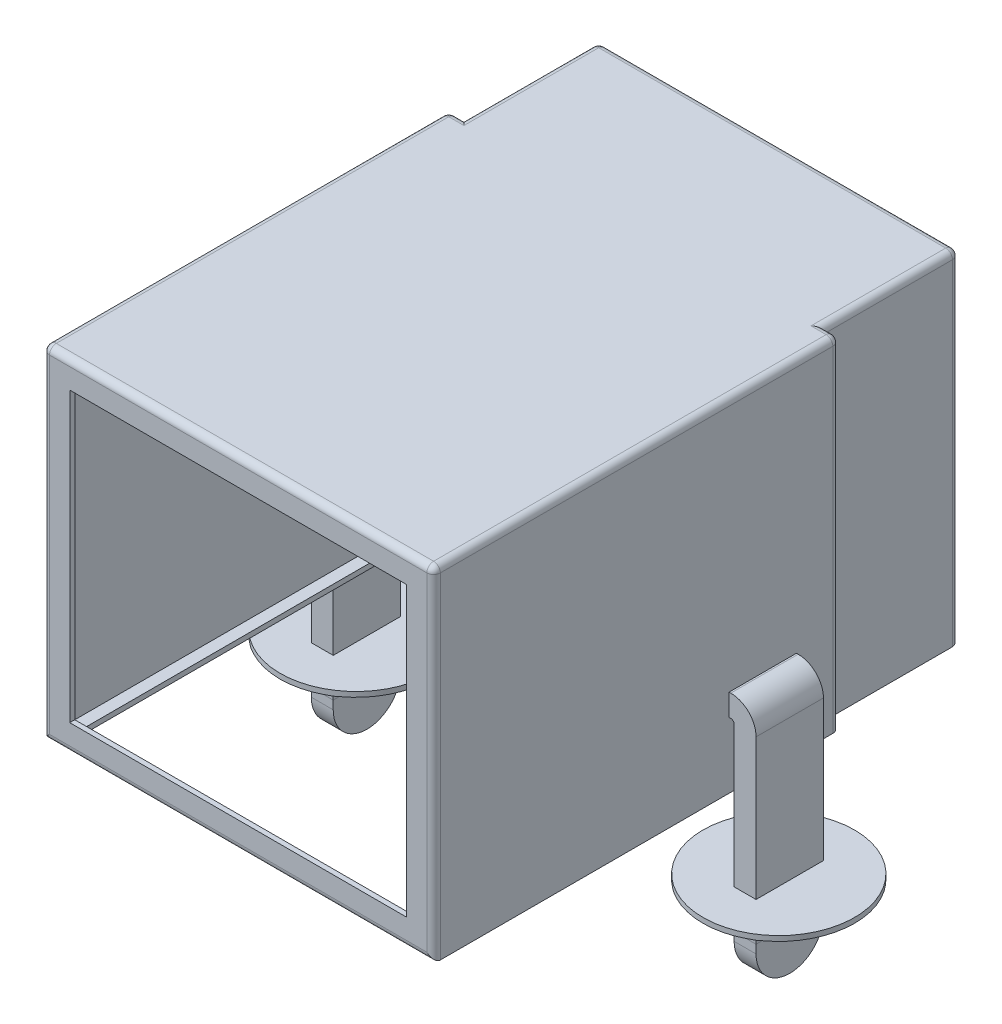
from build123d import *

# Parameters (mm, degrees)
BOSS_EXTRUDE1_DEPTH      = 0.15
BOSS_EXTRUDE1_DEPTH_BACK = 10
BOSS_EXTRUDE2_DEPTH      = 0.15
BOSS_EXTRUDE3_DEPTH      = 0.15
SKETCH6_W                = 10
SKETCH6_H                = 8.55
CUT_EXTRUDE1_DEPTH       = 0.15
CUT_EXTRUDE3_DEPTH       = 0.15
INDENT1_START            = -4.25
INDENT1_OUTLINE_W        = 0.15
INDENT1_OUTLINE_H        = 0.35
INDENT1_DEPTH            = 1
INDENT1_START_2          = -0.5
INDENT1_2_OUTLINE_W      = 0.15
INDENT1_2_OUTLINE_H      = 0.35
INDENT1_2_DEPTH          = 1
INDENT1_START_3          = 3.25
INDENT1_3_OUTLINE_W      = 0.15
INDENT1_3_OUTLINE_H      = 0.35
INDENT1_3_DEPTH          = 1
EXTRUDE_THIN2_DEPTH      = 2
FILLET1_R                = 1
FILLET1_OF_MIRROR1_R     = 1
SKETCH10_R               = 2.25
BOSS_EXTRUDE4_DEPTH      = 0.15
FILLET2_R                = 1
FILLET4_R                = 0.2
FILLET5_R                = 0.2
FILLET6_R                = 0.2


# Read off the part's stored shape, not the designer's step: Indent1
# Some blends are built 0.0001 mm under size
with BuildPart() as part:
    # Sketch1 → Boss-Extrude1 (new, two sides: drawn at the far end of the back side and taken through both)
    with BuildSketch(Plane(origin=(0, 10.25, 0), x_dir=(1, 0, 0), z_dir=(0, 1, 0)).offset(-BOSS_EXTRUDE1_DEPTH_BACK)):
        Polygon((5.8, 12.28), (5.35, 12.28), (5.35, 16.28), (-5.35, 16.28), (-5.35, 12.28), (-5.8, 12.28), (-5.8, 0.23), (5.8, 0.23), align=None)
        Polygon((5.65, 12.13), (5.2, 12.13), (5.2, 16.13), (-5.2, 16.13), (-5.2, 12.13), (-5.65, 12.13), (-5.65, 0.38), (5.65, 0.38), align=None, mode=Mode.SUBTRACT)
    extrude(amount=BOSS_EXTRUDE1_DEPTH + BOSS_EXTRUDE1_DEPTH_BACK)

    # Sketch4 → Boss-Extrude2 (add)
    with BuildSketch(Plane(origin=(0, 10.4, 0), x_dir=(1, 0, 0), z_dir=(0, 1, 0))):
        Polygon((5.8, 0.23), (5.8, 12.28), (5.35, 12.28), (5.35, 16.28), (-5.35, 16.28), (-5.35, 12.28), (-5.8, 12.28), (-5.8, 0.23), align=None)
    extrude(amount=-BOSS_EXTRUDE2_DEPTH)

    # Sketch5 → Boss-Extrude3 (add)
    with BuildSketch(Plane.XZ.offset(-0.25)):
        Polygon((5.8, -12.28), (5.8, -0.23), (-5.8, -0.23), (-5.8, -12.28), (-5.35, -12.28), (-5.35, -16.28), (5.35, -16.28), (5.35, -12.28), align=None)
    extrude(amount=-BOSS_EXTRUDE3_DEPTH)

    # Sketch6 → Cut-Extrude1 (cut)
    with BuildSketch(Plane.XY.offset(-0.23)):
        with Locations((0, 5.325)):
            Rectangle(SKETCH6_W, SKETCH6_H)
    extrude(amount=-CUT_EXTRUDE1_DEPTH, mode=Mode.SUBTRACT)

    # Sketch7 → Cut-Extrude3 (cut)
    with BuildSketch(Plane.XZ.offset(-0.25)):
        Polygon((4.85, -15.78), (4.85, -11.78), (5.3, -11.78), (5.3, -0.73), (-5.3, -0.73), (-5.3, -11.78), (-4.85, -11.78), (-4.85, -15.78), align=None)
    extrude(amount=-CUT_EXTRUDE3_DEPTH, mode=Mode.SUBTRACT)

    # Indent1 outline → Indent1 (cut)
    with BuildSketch(Plane.YZ.offset(INDENT1_START)):
        with Locations((0.325, -15.955)):
            Rectangle(INDENT1_OUTLINE_W, INDENT1_OUTLINE_H)
    extrude(amount=INDENT1_DEPTH, mode=Mode.SUBTRACT)

    # Indent1 2 outline → Indent1 2 (cut)
    with BuildSketch(Plane.YZ.offset(INDENT1_START_2)):
        with Locations((0.325, -15.955)):
            Rectangle(INDENT1_2_OUTLINE_W, INDENT1_2_OUTLINE_H)
    extrude(amount=INDENT1_2_DEPTH, mode=Mode.SUBTRACT)

    # Indent1 3 outline → Indent1 3 (cut)
    with BuildSketch(Plane.YZ.offset(INDENT1_START_3)):
        with Locations((0.325, -15.955)):
            Rectangle(INDENT1_3_OUTLINE_W, INDENT1_3_OUTLINE_H)
    extrude(amount=INDENT1_3_DEPTH, mode=Mode.SUBTRACT)

    # Sketch9 → Extrude-Thin2 (add)
    with BuildSketch(Plane.XY.offset(-11)):
        with BuildLine():
            Line((5.8, 2.2), (5.85, 2.2))
            ThreePointArc((5.85, 2.2), (5.920710678, 2.170710678), (5.95, 2.1))
            Line((5.95, 2.1), (5.95, -4.48))
            Line((5.95, -4.48), (6.6, -4.48))
            Line((6.6, -4.48), (6.6, 2.1))
            ThreePointArc((6.6, 2.1), (6.380330086, 2.630330086), (5.85, 2.85))
            Line((5.85, 2.85), (5.8, 2.85))
            Line((5.8, 2.85), (5.8, 2.2))
        make_face()
    extrude_thin2 = extrude(amount=EXTRUDE_THIN2_DEPTH)

    # Fillet1
    fillet1_edges = [part.edges().sort_by_distance(p)[0] for p in [
        (6.275, -4.48, -11),
        (6.275, -4.48, -9),
    ]]
    fillet(fillet1_edges, radius=FILLET1_R - 0.0001)  # a hair under: the kernel refuses the full size

    # Mirror1: Extrude-Thin2 across plane
    add(extrude_thin2.mirror(Plane(origin=(0, 0, 0), x_dir=(0, 0, 1), z_dir=(1, 0, 0))))

    # Fillet1 of Mirror1
    fillet1_of_mirror1_edges = [part.edges().sort_by_distance(p)[0] for p in [
        (-6.275, -4.48, -11),
        (-6.275, -4.48, -9),
    ]]
    fillet(fillet1_of_mirror1_edges, radius=FILLET1_OF_MIRROR1_R - 0.0001)  # a hair under: the kernel refuses the full size

    # Sketch10 → Boss-Extrude4 (add)
    with BuildSketch(Plane(origin=(0, -2.08, 0), x_dir=(-1, 0, 0), z_dir=(0, -1, 0))):
        with Locations(Location((-6.275, 10, 0), (0, 0, 90))):
            Circle(SKETCH10_R)
        with Locations(Location((6.275, 10, 0), (0, 0, 90))):
            Circle(SKETCH10_R)
    extrude(amount=BOSS_EXTRUDE4_DEPTH)

    # Fillet2
    # the kernel refuses this fillet: 1 mm, written as the material it adds along each edge
    with BuildSketch(Plane(origin=(5.95, -2.23, -11), x_dir=(0, 0, -1), z_dir=(1, 0, 0)), Plane(origin=(-5.95, -2.23, -9), x_dir=(0, 0, 1), z_dir=(-1, 0, 0))) as fillet2_piece_1:
        with BuildLine():
            CenterArc((FILLET2_R, -FILLET2_R), FILLET2_R, 90, 90)
            Line((0, -FILLET2_R), (0, 0))
            Line((0, 0), (FILLET2_R, 0))
        make_face()
    extrude(amount=0.65)
    with BuildSketch(Plane(origin=(5.95, -2.23, -9), x_dir=(-1, 0, 0), z_dir=(0, 0, -1)), Plane(origin=(6.6, -2.23, -11), x_dir=(1, 0, 0), z_dir=(0, 0, 1))) as fillet2_piece_2:
        with BuildLine():
            CenterArc((FILLET2_R, -FILLET2_R), FILLET2_R, 90, 90)
            Line((0, -FILLET2_R), (0, 0))
            Line((0, 0), (FILLET2_R, 0))
        make_face()
    extrude(amount=2)
    with BuildSketch(Plane(origin=(5.95, -2.23, -9), x_dir=(0, 0, 1), z_dir=(1, 0, 0)), Plane(origin=(-5.95, -2.23, -11), x_dir=(0, 0, -1), z_dir=(-1, 0, 0))) as fillet2_piece_3:
        with BuildLine():
            CenterArc((FILLET2_R, FILLET2_R), FILLET2_R, 180, 90)
            Line((0, FILLET2_R), (0, 0))
            Line((0, 0), (FILLET2_R, 0))
        make_face()
    extrude(amount=0.65)
    with BuildSketch(Plane(origin=(-6.6, -2.23, -11), x_dir=(-1, 0, 0), z_dir=(0, 0, 1)), Plane(origin=(-5.95, -2.23, -9), x_dir=(1, 0, 0), z_dir=(0, 0, -1))) as fillet2_piece_4:
        with BuildLine():
            CenterArc((FILLET2_R, FILLET2_R), FILLET2_R, 180, 90)
            Line((0, FILLET2_R), (0, 0))
            Line((0, 0), (FILLET2_R, 0))
        make_face()
    extrude(amount=2)
    with BuildSketch(Plane(origin=(3.45, -2.23, -11), x_dir=(0, 0, -1), z_dir=(1, 0, 0))) as fillet2_piece_5a_section:
        with BuildLine():
            CenterArc((FILLET2_R, -FILLET2_R), FILLET2_R, 90, 90)
            Line((0, -FILLET2_R), (0, 0))
            Line((0, 0), (FILLET2_R, 0))
        make_face()
    fillet2_piece_5a = extrude(amount=3.15, mode=Mode.PRIVATE)
    fillet2_piece_5a = fillet2_piece_5a & Plane(origin=(6.275, -2.469343422, -10), x_dir=(0, 0, -1), z_dir=(0, 1, 0)) * Cylinder(2.25, 11, mode=Mode.PRIVATE)
    fillet2_piece_5a = split(fillet2_piece_5a, bisect_by=Plane(origin=(5.95, -2.469343422, -11.202931819), z_dir=(-1, 0, 0)), keep=Keep.TOP, mode=Mode.PRIVATE)
    with BuildSketch(Plane(origin=(5.95, -2.23, -9), x_dir=(-1, 0, 0), z_dir=(0, 0, -1))) as fillet2_piece_5b_section:
        with BuildLine():
            CenterArc((FILLET2_R, -FILLET2_R), FILLET2_R, 90, 90)
            Line((0, -FILLET2_R), (0, 0))
            Line((0, 0), (FILLET2_R, 0))
        make_face()
    fillet2_piece_5b = extrude(amount=4.5, mode=Mode.PRIVATE)
    fillet2_piece_5b = fillet2_piece_5b & Plane(origin=(6.275, -2.463222845, -10), x_dir=(0, 0, -1), z_dir=(0, 1, 0)) * Cylinder(2.25, 13, mode=Mode.PRIVATE)
    fillet2_piece_5b = split(fillet2_piece_5b, bisect_by=Plane(origin=(5.736277315, -2.463222845, -11), z_dir=(0, 0, -1)), keep=Keep.TOP, mode=Mode.PRIVATE)
    fillet2_piece_5 = fillet2_piece_5a & fillet2_piece_5b
    add(fillet2_piece_5)
    with BuildSketch(Plane(origin=(5.95, -2.23, -11), x_dir=(0, 0, -1), z_dir=(1, 0, 0))) as fillet2_piece_6a_section:
        with BuildLine():
            CenterArc((FILLET2_R, -FILLET2_R), FILLET2_R, 90, 90)
            Line((0, -FILLET2_R), (0, 0))
            Line((0, 0), (FILLET2_R, 0))
        make_face()
    fillet2_piece_6a = extrude(amount=3.15, mode=Mode.PRIVATE)
    fillet2_piece_6a = fillet2_piece_6a & Plane(origin=(6.275, -2.469343173, -10), x_dir=(0, 0, -1), z_dir=(0, 1, 0)) * Cylinder(2.25, 11, mode=Mode.PRIVATE)
    fillet2_piece_6a = split(fillet2_piece_6a, bisect_by=Plane(origin=(6.6, -2.469343173, -11.202931595), z_dir=(1, 0, 0)), keep=Keep.TOP, mode=Mode.PRIVATE)
    with BuildSketch(Plane(origin=(6.6, -2.23, -13.5), x_dir=(1, 0, 0), z_dir=(0, 0, 1))) as fillet2_piece_6b_section:
        with BuildLine():
            CenterArc((FILLET2_R, -FILLET2_R), FILLET2_R, 90, 90)
            Line((0, -FILLET2_R), (0, 0))
            Line((0, 0), (FILLET2_R, 0))
        make_face()
    fillet2_piece_6b = extrude(amount=4.5, mode=Mode.PRIVATE)
    fillet2_piece_6b = fillet2_piece_6b & Plane(origin=(6.275, -2.463222813, -10), x_dir=(0, 0, -1), z_dir=(0, 1, 0)) * Cylinder(2.25, 13, mode=Mode.PRIVATE)
    fillet2_piece_6b = split(fillet2_piece_6b, bisect_by=Plane(origin=(6.813722651, -2.463222813, -11), z_dir=(0, 0, -1)), keep=Keep.TOP, mode=Mode.PRIVATE)
    fillet2_piece_6 = fillet2_piece_6a & fillet2_piece_6b
    add(fillet2_piece_6)
    with BuildSketch(Plane(origin=(3.45, -2.23, -9), x_dir=(0, 0, 1), z_dir=(1, 0, 0))) as fillet2_piece_7a_section:
        with BuildLine():
            CenterArc((FILLET2_R, FILLET2_R), FILLET2_R, 180, 90)
            Line((0, FILLET2_R), (0, 0))
            Line((0, 0), (FILLET2_R, 0))
        make_face()
    fillet2_piece_7a = extrude(amount=3.15, mode=Mode.PRIVATE)
    fillet2_piece_7a = fillet2_piece_7a & Plane(origin=(6.275, -2.469343173, -10), x_dir=(0, 0, -1), z_dir=(0, 1, 0)) * Cylinder(2.25, 11, mode=Mode.PRIVATE)
    fillet2_piece_7a = split(fillet2_piece_7a, bisect_by=Plane(origin=(5.95, -2.469343173, -8.797068405), z_dir=(-1, 0, 0)), keep=Keep.TOP, mode=Mode.PRIVATE)
    with BuildSketch(Plane(origin=(5.95, -2.23, -6.5), x_dir=(-1, 0, 0), z_dir=(0, 0, -1))) as fillet2_piece_7b_section:
        with BuildLine():
            CenterArc((FILLET2_R, -FILLET2_R), FILLET2_R, 90, 90)
            Line((0, -FILLET2_R), (0, 0))
            Line((0, 0), (FILLET2_R, 0))
        make_face()
    fillet2_piece_7b = extrude(amount=4.5, mode=Mode.PRIVATE)
    fillet2_piece_7b = fillet2_piece_7b & Plane(origin=(6.275, -2.463222813, -10), x_dir=(0, 0, -1), z_dir=(0, 1, 0)) * Cylinder(2.25, 13, mode=Mode.PRIVATE)
    fillet2_piece_7b = split(fillet2_piece_7b, bisect_by=Plane(origin=(5.736277349, -2.463222813, -9), z_dir=(0, 0, 1)), keep=Keep.TOP, mode=Mode.PRIVATE)
    fillet2_piece_7 = fillet2_piece_7a & fillet2_piece_7b
    add(fillet2_piece_7)
    with BuildSketch(Plane(origin=(6.6, -2.23, -11), x_dir=(1, 0, 0), z_dir=(0, 0, 1))) as fillet2_piece_8a_section:
        with BuildLine():
            CenterArc((FILLET2_R, -FILLET2_R), FILLET2_R, 90, 90)
            Line((0, -FILLET2_R), (0, 0))
            Line((0, 0), (FILLET2_R, 0))
        make_face()
    fillet2_piece_8a = extrude(amount=4.5, mode=Mode.PRIVATE)
    fillet2_piece_8a = fillet2_piece_8a & Plane(origin=(6.275, -2.463222845, -10), x_dir=(0, 0, -1), z_dir=(0, 1, 0)) * Cylinder(2.25, 13, mode=Mode.PRIVATE)
    fillet2_piece_8a = split(fillet2_piece_8a, bisect_by=Plane(origin=(6.813722685, -2.463222845, -9), z_dir=(0, 0, 1)), keep=Keep.TOP, mode=Mode.PRIVATE)
    with BuildSketch(Plane(origin=(5.95, -2.23, -9), x_dir=(0, 0, 1), z_dir=(1, 0, 0))) as fillet2_piece_8b_section:
        with BuildLine():
            CenterArc((FILLET2_R, FILLET2_R), FILLET2_R, 180, 90)
            Line((0, FILLET2_R), (0, 0))
            Line((0, 0), (FILLET2_R, 0))
        make_face()
    fillet2_piece_8b = extrude(amount=3.15, mode=Mode.PRIVATE)
    fillet2_piece_8b = fillet2_piece_8b & Plane(origin=(6.275, -2.469343422, -10), x_dir=(0, 0, -1), z_dir=(0, 1, 0)) * Cylinder(2.25, 11, mode=Mode.PRIVATE)
    fillet2_piece_8b = split(fillet2_piece_8b, bisect_by=Plane(origin=(6.6, -2.469343422, -8.797068181), z_dir=(1, 0, 0)), keep=Keep.TOP, mode=Mode.PRIVATE)
    fillet2_piece_8 = fillet2_piece_8a & fillet2_piece_8b
    add(fillet2_piece_8)
    with BuildSketch(Plane(origin=(-3.45, -2.23, -11), x_dir=(0, 0, -1), z_dir=(-1, 0, 0))) as fillet2_piece_9a_section:
        with BuildLine():
            CenterArc((FILLET2_R, FILLET2_R), FILLET2_R, 180, 90)
            Line((0, FILLET2_R), (0, 0))
            Line((0, 0), (FILLET2_R, 0))
        make_face()
    fillet2_piece_9a = extrude(amount=3.15, mode=Mode.PRIVATE)
    fillet2_piece_9a = fillet2_piece_9a & Plane(origin=(-6.275, -2.469343173, -10), x_dir=(0, 0, -1), z_dir=(0, 1, 0)) * Cylinder(2.25, 11, mode=Mode.PRIVATE)
    fillet2_piece_9a = split(fillet2_piece_9a, bisect_by=Plane(origin=(-5.95, -2.469343173, -11.202931595), z_dir=(1, 0, 0)), keep=Keep.TOP, mode=Mode.PRIVATE)
    with BuildSketch(Plane(origin=(-5.95, -2.23, -9), x_dir=(1, 0, 0), z_dir=(0, 0, -1))) as fillet2_piece_9b_section:
        with BuildLine():
            CenterArc((FILLET2_R, FILLET2_R), FILLET2_R, 180, 90)
            Line((0, FILLET2_R), (0, 0))
            Line((0, 0), (FILLET2_R, 0))
        make_face()
    fillet2_piece_9b = extrude(amount=4.5, mode=Mode.PRIVATE)
    fillet2_piece_9b = fillet2_piece_9b & Plane(origin=(-6.275, -2.463222813, -10), x_dir=(0, 0, -1), z_dir=(0, 1, 0)) * Cylinder(2.25, 13, mode=Mode.PRIVATE)
    fillet2_piece_9b = split(fillet2_piece_9b, bisect_by=Plane(origin=(-5.736277349, -2.463222813, -11), z_dir=(0, 0, -1)), keep=Keep.TOP, mode=Mode.PRIVATE)
    fillet2_piece_9 = fillet2_piece_9a & fillet2_piece_9b
    add(fillet2_piece_9)
    with BuildSketch(Plane(origin=(-6.6, -2.23, -13.5), x_dir=(-1, 0, 0), z_dir=(0, 0, 1))) as fillet2_piece_10a_section:
        with BuildLine():
            CenterArc((FILLET2_R, FILLET2_R), FILLET2_R, 180, 90)
            Line((0, FILLET2_R), (0, 0))
            Line((0, 0), (FILLET2_R, 0))
        make_face()
    fillet2_piece_10a = extrude(amount=4.5, mode=Mode.PRIVATE)
    fillet2_piece_10a = fillet2_piece_10a & Plane(origin=(-6.275, -2.463222845, -10), x_dir=(0, 0, -1), z_dir=(0, 1, 0)) * Cylinder(2.25, 13, mode=Mode.PRIVATE)
    fillet2_piece_10a = split(fillet2_piece_10a, bisect_by=Plane(origin=(-6.813722685, -2.463222845, -11), z_dir=(0, 0, -1)), keep=Keep.TOP, mode=Mode.PRIVATE)
    with BuildSketch(Plane(origin=(-5.95, -2.23, -11), x_dir=(0, 0, -1), z_dir=(-1, 0, 0))) as fillet2_piece_10b_section:
        with BuildLine():
            CenterArc((FILLET2_R, FILLET2_R), FILLET2_R, 180, 90)
            Line((0, FILLET2_R), (0, 0))
            Line((0, 0), (FILLET2_R, 0))
        make_face()
    fillet2_piece_10b = extrude(amount=3.15, mode=Mode.PRIVATE)
    fillet2_piece_10b = fillet2_piece_10b & Plane(origin=(-6.275, -2.469343422, -10), x_dir=(0, 0, -1), z_dir=(0, 1, 0)) * Cylinder(2.25, 11, mode=Mode.PRIVATE)
    fillet2_piece_10b = split(fillet2_piece_10b, bisect_by=Plane(origin=(-6.6, -2.469343422, -11.202931819), z_dir=(-1, 0, 0)), keep=Keep.TOP, mode=Mode.PRIVATE)
    fillet2_piece_10 = fillet2_piece_10a & fillet2_piece_10b
    add(fillet2_piece_10)
    with BuildSketch(Plane(origin=(-5.95, -2.23, -9), x_dir=(0, 0, 1), z_dir=(-1, 0, 0))) as fillet2_piece_11a_section:
        with BuildLine():
            CenterArc((FILLET2_R, -FILLET2_R), FILLET2_R, 90, 90)
            Line((0, -FILLET2_R), (0, 0))
            Line((0, 0), (FILLET2_R, 0))
        make_face()
    fillet2_piece_11a = extrude(amount=3.15, mode=Mode.PRIVATE)
    fillet2_piece_11a = fillet2_piece_11a & Plane(origin=(-6.275, -2.469343173, -10), x_dir=(0, 0, -1), z_dir=(0, 1, 0)) * Cylinder(2.25, 11, mode=Mode.PRIVATE)
    fillet2_piece_11a = split(fillet2_piece_11a, bisect_by=Plane(origin=(-6.6, -2.469343173, -8.797068405), z_dir=(-1, 0, 0)), keep=Keep.TOP, mode=Mode.PRIVATE)
    with BuildSketch(Plane(origin=(-6.6, -2.23, -11), x_dir=(-1, 0, 0), z_dir=(0, 0, 1))) as fillet2_piece_11b_section:
        with BuildLine():
            CenterArc((FILLET2_R, FILLET2_R), FILLET2_R, 180, 90)
            Line((0, FILLET2_R), (0, 0))
            Line((0, 0), (FILLET2_R, 0))
        make_face()
    fillet2_piece_11b = extrude(amount=4.5, mode=Mode.PRIVATE)
    fillet2_piece_11b = fillet2_piece_11b & Plane(origin=(-6.275, -2.463222813, -10), x_dir=(0, 0, -1), z_dir=(0, 1, 0)) * Cylinder(2.25, 13, mode=Mode.PRIVATE)
    fillet2_piece_11b = split(fillet2_piece_11b, bisect_by=Plane(origin=(-6.813722651, -2.463222813, -9), z_dir=(0, 0, 1)), keep=Keep.TOP, mode=Mode.PRIVATE)
    fillet2_piece_11 = fillet2_piece_11a & fillet2_piece_11b
    add(fillet2_piece_11)
    with BuildSketch(Plane(origin=(-3.45, -2.23, -9), x_dir=(0, 0, 1), z_dir=(-1, 0, 0))) as fillet2_piece_12a_section:
        with BuildLine():
            CenterArc((FILLET2_R, -FILLET2_R), FILLET2_R, 90, 90)
            Line((0, -FILLET2_R), (0, 0))
            Line((0, 0), (FILLET2_R, 0))
        make_face()
    fillet2_piece_12a = extrude(amount=3.15, mode=Mode.PRIVATE)
    fillet2_piece_12a = fillet2_piece_12a & Plane(origin=(-6.275, -2.469343422, -10), x_dir=(0, 0, -1), z_dir=(0, 1, 0)) * Cylinder(2.25, 11, mode=Mode.PRIVATE)
    fillet2_piece_12a = split(fillet2_piece_12a, bisect_by=Plane(origin=(-5.95, -2.469343422, -8.797068181), z_dir=(1, 0, 0)), keep=Keep.TOP, mode=Mode.PRIVATE)
    with BuildSketch(Plane(origin=(-5.95, -2.23, -6.5), x_dir=(1, 0, 0), z_dir=(0, 0, -1))) as fillet2_piece_12b_section:
        with BuildLine():
            CenterArc((FILLET2_R, FILLET2_R), FILLET2_R, 180, 90)
            Line((0, FILLET2_R), (0, 0))
            Line((0, 0), (FILLET2_R, 0))
        make_face()
    fillet2_piece_12b = extrude(amount=4.5, mode=Mode.PRIVATE)
    fillet2_piece_12b = fillet2_piece_12b & Plane(origin=(-6.275, -2.463222845, -10), x_dir=(0, 0, -1), z_dir=(0, 1, 0)) * Cylinder(2.25, 13, mode=Mode.PRIVATE)
    fillet2_piece_12b = split(fillet2_piece_12b, bisect_by=Plane(origin=(-5.736277315, -2.463222845, -9), z_dir=(0, 0, 1)), keep=Keep.TOP, mode=Mode.PRIVATE)
    fillet2_piece_12 = fillet2_piece_12a & fillet2_piece_12b
    add(fillet2_piece_12)

    # Fillet4
    fillet4_edges = [part.edges().sort_by_distance(p)[0] for p in [
        (5.35, 10.4, -14.28),
        (0, 10.4, -16.28),
        (-5.35, 10.4, -14.28),
        (-5.575, 10.4, -12.28),
        (-5.8, 10.4, -6.255),
        (0, 10.4, -0.23),
        (5.8, 10.4, -6.255),
        (5.575, 10.4, -12.28),
    ]]
    fillet(fillet4_edges, radius=FILLET4_R)

    # Fillet5
    # the kernel refuses this fillet: 0.2 mm, written as the material it takes off along each edge
    with BuildSketch(Plane(origin=(5.15, 10.2, -16.08), x_dir=(0, 0, -1), z_dir=(1, 0, 0))) as fillet5_piece_1_section:
        Polygon((0, 0), (FILLET5_R, 0), (FILLET5_R, FILLET5_R), (0, FILLET5_R), align=None)
    fillet5_piece_1 = extrude(amount=FILLET5_R, mode=Mode.PRIVATE)
    fillet5_piece_1 = fillet5_piece_1 - Plane(origin=(5.15, 10.2, -16.08), x_dir=(0, -0.7071067811865475, 0.7071067811865475), z_dir=(1, 0, 0)) * Sphere(FILLET5_R, mode=Mode.PRIVATE)
    add(fillet5_piece_1, mode=Mode.SUBTRACT)
    with BuildSketch(Plane(origin=(-5.15, 10.2, -16.08), x_dir=(0, 0, -1), z_dir=(-1, 0, 0))) as fillet5_piece_2_section:
        Polygon((0, 0), (FILLET5_R, 0), (FILLET5_R, -FILLET5_R), (0, -FILLET5_R), align=None)
    fillet5_piece_2 = extrude(amount=FILLET5_R, mode=Mode.PRIVATE)
    fillet5_piece_2 = fillet5_piece_2 - Plane(origin=(-5.15, 10.2, -16.08), x_dir=(0, -0.7071067811865475, 0.7071067811865475), z_dir=(-1, 0, 0)) * Sphere(FILLET5_R, mode=Mode.PRIVATE)
    add(fillet5_piece_2, mode=Mode.SUBTRACT)
    with BuildSketch(Plane(origin=(-5.6, 10.2, -0.43), x_dir=(0, 0, 1), z_dir=(-1, 0, 0))) as fillet5_piece_3_section:
        Polygon((0, 0), (FILLET5_R, 0), (FILLET5_R, FILLET5_R), (0, FILLET5_R), align=None)
    fillet5_piece_3 = extrude(amount=FILLET5_R, mode=Mode.PRIVATE)
    fillet5_piece_3 = fillet5_piece_3 - Plane(origin=(-5.6, 10.2, -0.43), x_dir=(0, -0.7071067811865475, -0.7071067811865475), z_dir=(-1, 0, 0)) * Sphere(FILLET5_R, mode=Mode.PRIVATE)
    add(fillet5_piece_3, mode=Mode.SUBTRACT)
    with BuildSketch(Plane(origin=(5.6, 10.2, -0.43), x_dir=(1, 0, 0), z_dir=(0, 0, 1))) as fillet5_piece_4_section:
        Polygon((0, 0), (FILLET5_R, 0), (FILLET5_R, FILLET5_R), (0, FILLET5_R), align=None)
    fillet5_piece_4 = extrude(amount=FILLET5_R, mode=Mode.PRIVATE)
    fillet5_piece_4 = fillet5_piece_4 - Plane(origin=(5.6, 10.2, -0.43), x_dir=(-0.7071067811865475, -0.7071067811865475, 0), z_dir=(0, 0, 1)) * Sphere(FILLET5_R, mode=Mode.PRIVATE)
    add(fillet5_piece_4, mode=Mode.SUBTRACT)
    with BuildSketch(Plane(origin=(5.85, 0.25, -16.28), x_dir=(0, 0, 1), z_dir=(-1, 0, 0))) as fillet5_piece_5:
        with BuildLine():
            CenterArc((FILLET5_R, FILLET5_R), FILLET5_R, 180, 90)
            Line((0, FILLET5_R), (0, 0))
            Line((0, 0), (FILLET5_R, 0))
        make_face()
    extrude(amount=11.7, mode=Mode.SUBTRACT)
    with BuildSketch(Plane(origin=(5.35, -0.25, -16.28), x_dir=(0, 0, 1), z_dir=(0, 1, 0))) as fillet5_piece_6:
        with BuildLine():
            CenterArc((FILLET5_R, -FILLET5_R), FILLET5_R, 90, 90)
            Line((0, -FILLET5_R), (0, 0))
            Line((0, 0), (FILLET5_R, 0))
        make_face()
    extrude(amount=10.45, mode=Mode.SUBTRACT)
    with BuildSketch(Plane(origin=(-5.35, -0.25, -16.28), x_dir=(0, 0, 1), z_dir=(0, 1, 0)), Plane(origin=(-5.8, 10.2, -0.23), x_dir=(0, 0, -1), z_dir=(0, -1, 0)), Plane(origin=(5.8, 10.2, -0.23), x_dir=(-1, 0, 0), z_dir=(0, -1, 0))) as fillet5_piece_7:
        with BuildLine():
            CenterArc((FILLET5_R, FILLET5_R), FILLET5_R, 180, 90)
            Line((0, FILLET5_R), (0, 0))
            Line((0, 0), (FILLET5_R, 0))
        make_face()
    extrude(amount=10.45, mode=Mode.SUBTRACT)
    with BuildSketch(Plane(origin=(-6.3, 0.25, -0.23), x_dir=(0, 0, -1), z_dir=(1, 0, 0))) as fillet5_piece_8:
        with BuildLine():
            CenterArc((FILLET5_R, FILLET5_R), FILLET5_R, 180, 90)
            Line((0, FILLET5_R), (0, 0))
            Line((0, 0), (FILLET5_R, 0))
        make_face()
    extrude(amount=12.6, mode=Mode.SUBTRACT)

    # Fillet6
    # the kernel refuses this fillet: 0.2 mm, written as the material it takes off along each edge
    with BuildSketch(Plane(origin=(-5.6, 10.2, -12.08), x_dir=(0, 0, -1), z_dir=(-1, 0, 0))) as fillet6_piece_1_section:
        Polygon((0, 0), (FILLET6_R, 0), (FILLET6_R, -FILLET6_R), (0, -FILLET6_R), align=None)
    fillet6_piece_1 = extrude(amount=FILLET6_R, mode=Mode.PRIVATE)
    fillet6_piece_1 = fillet6_piece_1 - Plane(origin=(-5.6, 10.2, -12.08), x_dir=(0, -0.7071067811865475, 0.7071067811865475), z_dir=(-1, 0, 0)) * Sphere(FILLET6_R, mode=Mode.PRIVATE)
    add(fillet6_piece_1, mode=Mode.SUBTRACT)
    with BuildSketch(Plane(origin=(5.6, 10.2, -12.08), x_dir=(1, 0, 0), z_dir=(0, 0, -1))) as fillet6_piece_2_section:
        Polygon((0, 0), (FILLET6_R, 0), (FILLET6_R, -FILLET6_R), (0, -FILLET6_R), align=None)
    fillet6_piece_2 = extrude(amount=FILLET6_R, mode=Mode.PRIVATE)
    fillet6_piece_2 = fillet6_piece_2 - Plane(origin=(5.6, 10.2, -12.08), x_dir=(-0.7071067811865475, -0.7071067811865475, 0), z_dir=(0, 0, -1)) * Sphere(FILLET6_R, mode=Mode.PRIVATE)
    add(fillet6_piece_2, mode=Mode.SUBTRACT)
    with BuildSketch(Plane(origin=(-5.8, -0.25, -12.28), x_dir=(0, 0, 1), z_dir=(0, 1, 0))) as fillet6_piece_3:
        with BuildLine():
            CenterArc((FILLET6_R, FILLET6_R), FILLET6_R, 180, 90)
            Line((0, FILLET6_R), (0, 0))
            Line((0, 0), (FILLET6_R, 0))
        make_face()
    extrude(amount=10.45, mode=Mode.SUBTRACT)
    with BuildSketch(Plane(origin=(5.8, 10.2, -12.28), x_dir=(-1, 0, 0), z_dir=(0, -1, 0))) as fillet6_piece_4:
        with BuildLine():
            CenterArc((FILLET6_R, -FILLET6_R), FILLET6_R, 90, 90)
            Line((0, -FILLET6_R), (0, 0))
            Line((0, 0), (FILLET6_R, 0))
        make_face()
    extrude(amount=10.45, mode=Mode.SUBTRACT)


solid = part.part
